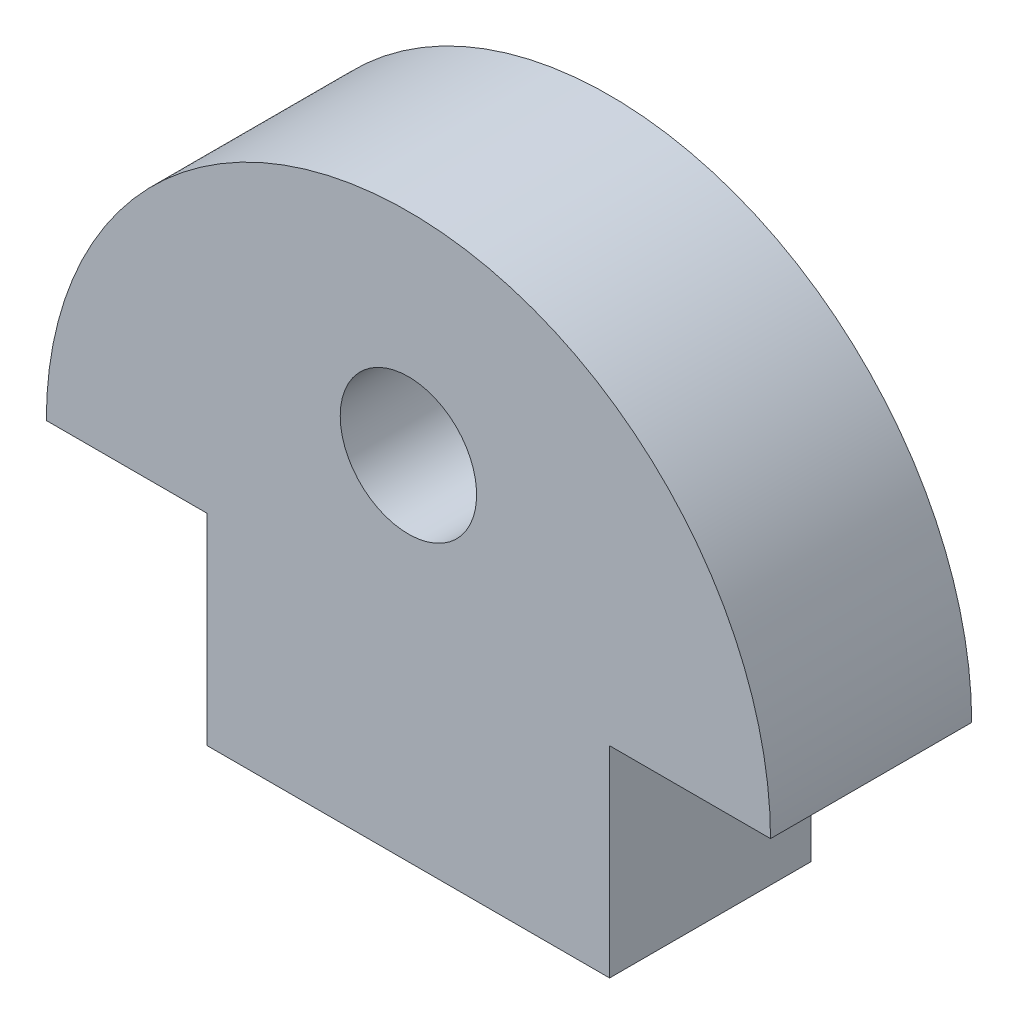
from build123d import *

# Parameters (mm, degrees)
BASE_DEPTH          = 6.35
AXLE_HOLE_D         = 4.3053
SKETCH8_W           = 12.7
SKETCH8_H           = 6.35
BOSS_EXTRUDE2_DEPTH = 6.35


with BuildPart() as part:
    # Sketch1 → Base (new body)
    with BuildSketch(Plane.XY):
        with BuildLine():
            Line((-11.43, -12.7), (11.43, -12.7))
            ThreePointArc((11.43, -12.7), (0, -1.27), (-11.43, -12.7))
        make_face()
    extrude(amount=BASE_DEPTH)

    # Axle hole (through all)
    with Locations(Plane(origin=(0, 0, 0), x_dir=(-1, 0, 0), z_dir=(0, 0, -1))):
        with Locations((0, -7.9375)):
            Hole(AXLE_HOLE_D / 2)

    # Sketch8 → Boss-Extrude2 (add)
    with BuildSketch(Plane.XY.offset(6.35)):
        with Locations((0, -15.875)):
            Rectangle(SKETCH8_W, SKETCH8_H)
    extrude(amount=-BOSS_EXTRUDE2_DEPTH)


solid = part.part
